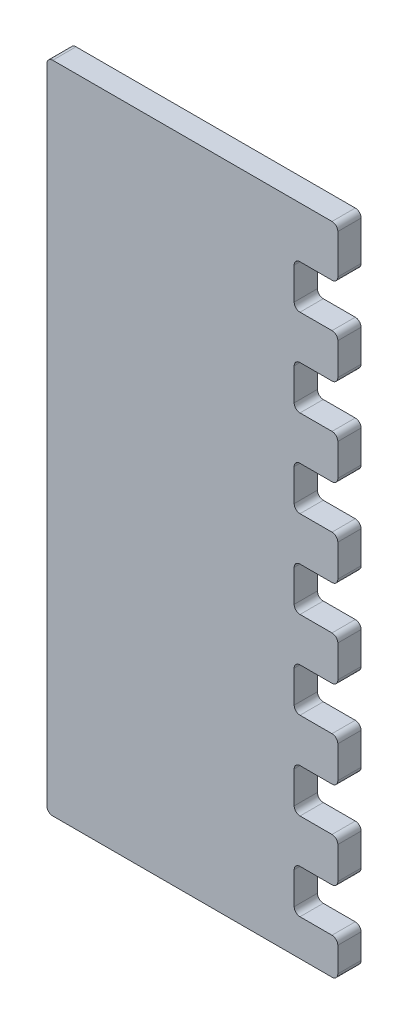
from build123d import *

# Parameters (mm, degrees)
SKETCH1_W           = 200
SKETCH1_H           = 450
BOSS_EXTRUDE1_DEPTH = 16
SKETCH2_W           = 30
SKETCH2_H           = 30
CUT_EXTRUDE8_DEPTH  = 462.254810273
LPATTERN1_COUNT     = 7
LPATTERN1_PITCH     = 60
FILLET1_R           = 4


with BuildPart() as part:
    # Sketch1 → Boss-Extrude1 (new body)
    with BuildSketch(Plane.XY):
        with Locations((0, 225)):
            Rectangle(SKETCH1_W, SKETCH1_H)
    extrude(amount=BOSS_EXTRUDE1_DEPTH)

    # Sketch2 → Cut-Extrude8 (cut, symmetric)
    with BuildSketch(Plane.XY.offset(16)):
        with Locations((85, 40)):
            Rectangle(SKETCH2_W, SKETCH2_H)
    cut_extrude8 = extrude(amount=CUT_EXTRUDE8_DEPTH, both=True, mode=Mode.SUBTRACT)

    # LPattern1: Cut-Extrude8 ×7
    with Locations(*[(0, i * LPATTERN1_PITCH, 0) for i in range(1, LPATTERN1_COUNT)]):
        add(cut_extrude8, mode=Mode.SUBTRACT)

    # Fillet1
    fillet1_edges = [part.edges().sort_by_distance(p)[0] for p in [
        (100, 145, 8),
        (70, 145, 8),
        (70, 175, 8),
        (100, 175, 8),
        (100, 205, 8),
        (70, 205, 8),
        (70, 235, 8),
        (100, 235, 8),
        (100, 265, 8),
        (70, 265, 8),
        (70, 295, 8),
        (100, 295, 8),
        (100, 325, 8),
        (70, 355, 8),
        (100, 355, 8),
        (100, 385, 8),
        (70, 385, 8),
        (70, 415, 8),
        (100, 415, 8),
        (100, 450, 8),
        (-100, 450, 8),
        (-100, 0, 8),
        (100, 0, 8),
        (100, 25, 8),
        (70, 25, 8),
        (70, 55, 8),
        (100, 55, 8),
        (100, 85, 8),
        (70, 85, 8),
        (70, 115, 8),
        (100, 115, 8),
        (70, 325, 8),
    ]]
    fillet(fillet1_edges, radius=FILLET1_R)


solid = part.part
